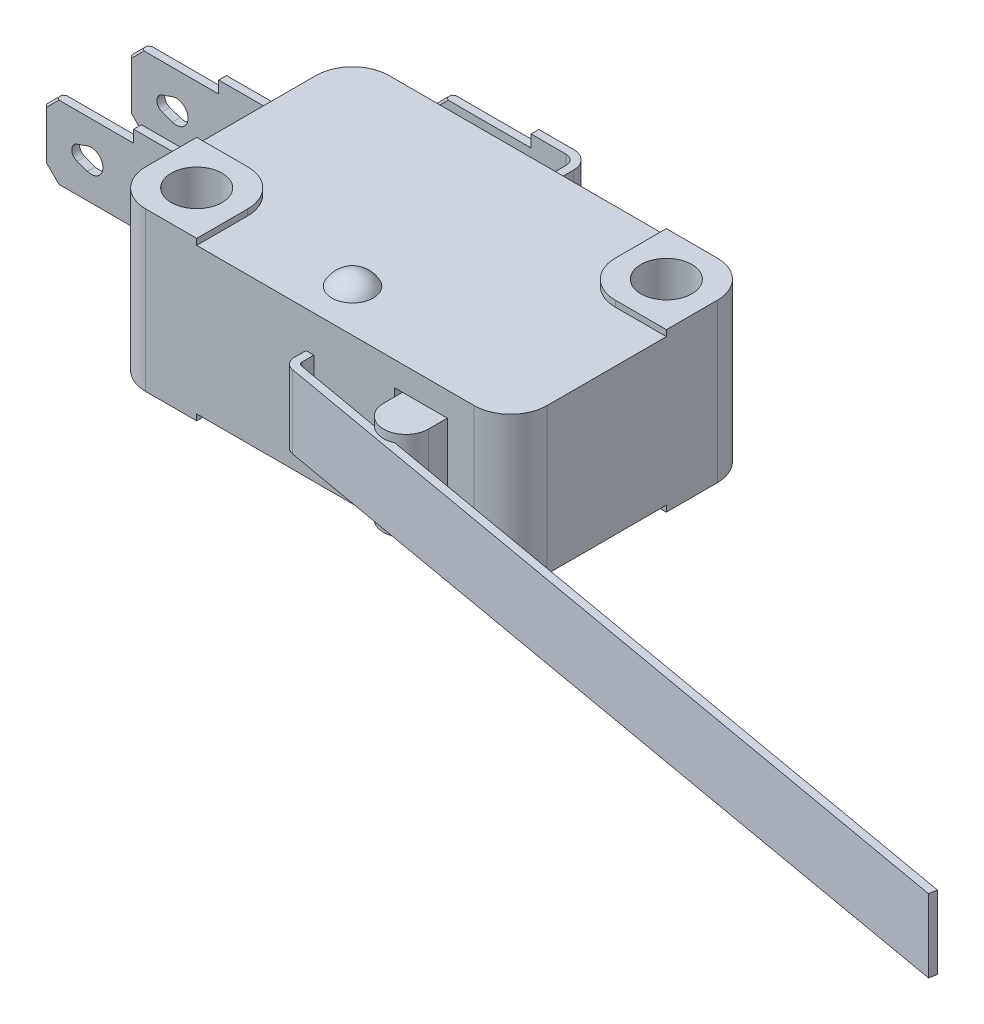
from build123d import *

# Parameters (mm, degrees)
BOSS_EXTRUDE1_DEPTH = 4.7625
BOSS_EXTRUDE2_DEPTH = 5.159375
BOSS_EXTRUDE3_DEPTH = 5.159375
SKETCH4_R           = 1.6637
CUT_EXTRUDE1_DEPTH  = 19.466419322
SKETCH5_W           = 2.38125
SKETCH5_H           = 5.55625
CUT_EXTRUDE2_DEPTH  = 2.38125
EXTRUDE_THIN1_DEPTH = 3.175
CUT_EXTRUDE3_REACH  = 25.891
SKETCH7_W           = 6.35
SKETCH7_H           = 0.79375
SKETCH8_W           = 10.31875
SKETCH8_H           = 0.508
EXTRUDE_THIN2_DEPTH = 3.175
SKETCH9_W           = 5.813488842
SKETCH9_H           = 0.79375
CUT_EXTRUDE4_DEPTH  = 72.39
CUT_EXTRUDE5_REACH  = 32.782
CUT_EXTRUDE6_DEPTH  = 27.884611297
CHAMFER1_SIZE       = 0.762
CHAMFER2_SIZE       = 0.127
SKETCH12_W          = 3.429
SKETCH12_H          = 6.35
CUT_EXTRUDE7_DEPTH  = 1.524
SKETCH13_W          = 2.921
SKETCH13_H          = 5.842
BOSS_EXTRUDE4_DEPTH = 3.96875
FILLET1_RADIUS      = 1.4605
FILLET1_LENGTH      = 5.842
EXTRUDE_THIN5_START = -2.38125
EXTRUDE_THIN5_DEPTH = 4.7625


# Read off the part's stored shape, not the designer's step: Extrude-Thin5
with BuildPart() as part:
    # Sketch1 → Boss-Extrude1 (new, symmetric)
    with BuildSketch(Plane(origin=(0, 0, 0), x_dir=(1, 0, 0), z_dir=(0, 1, 0))):
        with BuildLine():
            Line((-10.715625, 7.9375), (10.715625, 7.9375))
            ThreePointArc((10.715625, 7.9375), (12.399423023, 7.240048023), (13.096875, 5.55625))
            Line((13.096875, 5.55625), (13.096875, -5.55625))
            ThreePointArc((13.096875, -5.55625), (12.399423023, -7.240048023), (10.715625, -7.9375))
            Line((10.715625, -7.9375), (-10.715625, -7.9375))
            ThreePointArc((-10.715625, -7.9375), (-12.399423023, -7.240048023), (-13.096875, -5.55625))
            Line((-13.096875, -5.55625), (-13.096875, 5.55625))
            ThreePointArc((-13.096875, 5.55625), (-12.399423023, 7.240048023), (-10.715625, 7.9375))
        make_face()
    extrude(amount=BOSS_EXTRUDE1_DEPTH, both=True)

    # Sketch2 → Boss-Extrude2 (add, symmetric)
    with BuildSketch(Plane(origin=(0, 0, 0), x_dir=(1, 0, 0), z_dir=(0, 1, 0))):
        with BuildLine():
            Line((7.388225, 7.9375), (10.715625, 7.9375))
            ThreePointArc((10.715625, 7.9375), (12.399423023, 7.240048023), (13.096875, 5.55625))
            Line((13.096875, 5.55625), (13.096875, 2.22885))
            Line((13.096875, 2.22885), (9.769475, 2.22885))
            ThreePointArc((9.769475, 2.22885), (8.085676977, 2.926301977), (7.388225, 4.6101))
            Line((7.388225, 4.6101), (7.388225, 7.9375))
        make_face()
    extrude(amount=BOSS_EXTRUDE2_DEPTH, both=True)

    # Sketch3 → Boss-Extrude3 (add, symmetric)
    with BuildSketch(Plane(origin=(0, 0, 0), x_dir=(1, 0, 0), z_dir=(0, 1, 0))):
        with BuildLine():
            Line((-7.388225, -7.9375), (-10.715625, -7.9375))
            ThreePointArc((-10.715625, -7.9375), (-12.399423023, -7.240048023), (-13.096875, -5.55625))
            Line((-13.096875, -5.55625), (-13.096875, -2.22885))
            Line((-13.096875, -2.22885), (-9.769475, -2.22885))
            ThreePointArc((-9.769475, -2.22885), (-8.085676977, -2.926301977), (-7.388225, -4.6101))
            Line((-7.388225, -4.6101), (-7.388225, -7.9375))
        make_face()
    extrude(amount=BOSS_EXTRUDE3_DEPTH, both=True)

    # Sketch4 → Cut-Extrude1 (cut, through all)
    with BuildSketch(Plane(origin=(0, 5.159375, 0), x_dir=(1, 0, 0), z_dir=(0, 1, 0))):
        with Locations(Location((-10.24255, -5.083175, 0), (0, 0, 270))):
            Circle(SKETCH4_R)
        with Locations(Location((10.24255, 5.083175, 0), (0, 0, 270))):
            Circle(SKETCH4_R)
    extrude(amount=-CUT_EXTRUDE1_DEPTH, mode=Mode.SUBTRACT)

    # Sketch5 → Cut-Extrude2 (cut)
    with BuildSketch(Plane.ZY.offset(13.096875)):
        with Locations((-6.746875, 0)):
            Rectangle(SKETCH5_W, SKETCH5_H)
    extrude(amount=-CUT_EXTRUDE2_DEPTH, mode=Mode.SUBTRACT)

    # Sketch6 → Extrude-Thin1 (add, symmetric)
    with BuildSketch(Plane(origin=(0, 0, 0), x_dir=(1, 0, 0), z_dir=(0, 1, 0))):
        with BuildLine():
            Line((-0.936625, 7.9375), (-0.936625, 10.2235))
            ThreePointArc((-0.936625, 10.2235), (-1.271401949, 11.031723051), (-2.079625, 11.3665))
            Line((-2.079625, 11.3665), (-10.715625, 11.3665))
            Line((-10.715625, 11.3665), (-10.715625, 10.8585))
            Line((-10.715625, 10.8585), (-2.079625, 10.8585))
            ThreePointArc((-2.079625, 10.8585), (-1.630612194, 10.672512806), (-1.444625, 10.2235))
            Line((-1.444625, 10.2235), (-1.444625, 7.9375))
            Line((-1.444625, 7.9375), (-0.936625, 7.9375))
        make_face()
    extrude(amount=EXTRUDE_THIN1_DEPTH, both=True)

    # Sketch7 → Cut-Extrude3 (cut, up to next)
    with BuildSketch(Plane(origin=(0, 0, -11.3665), x_dir=(-1, 0, 0), z_dir=(0, 0, -1)), mode=Mode.PRIVATE) as cut_extrude3_sk1:
        with Locations((7.540625, 2.778125)):
            Rectangle(SKETCH7_W, SKETCH7_H)
    cut_extrude3_tool1 = extrude(cut_extrude3_sk1.sketch, amount=-CUT_EXTRUDE3_REACH, mode=Mode.PRIVATE) & part.part
    cut_extrude3 = cut_extrude3_tool1.solids().sort_by_distance((-7.540625, 2.778125, -11.3665))[0]
    add(cut_extrude3, mode=Mode.SUBTRACT)

    # Sketch8 → Extrude-Thin2 (add, symmetric)
    with BuildSketch(Plane(origin=(0, 0, 0), x_dir=(1, 0, 0), z_dir=(0, 1, 0))):
        with Locations((-18.25625, 3.96875)):
            Rectangle(SKETCH8_W, SKETCH8_H)
        with Locations((-18.25625, -1.5875)):
            Rectangle(SKETCH8_W, SKETCH8_H)
    extrude(amount=EXTRUDE_THIN2_DEPTH, both=True)

    # Sketch9 → Cut-Extrude4 (cut)
    with BuildSketch(Plane(origin=(0, 0, -4.22275), x_dir=(-1, 0, 0), z_dir=(0, 0, -1))):
        with Locations((20.508880579, 2.778125)):
            Rectangle(SKETCH9_W, SKETCH9_H)
    cut_extrude4 = extrude(amount=-CUT_EXTRUDE4_DEPTH, mode=Mode.SUBTRACT)

    # Mirror1: Cut-Extrude3, Cut-Extrude4 across plane
    add(cut_extrude3.mirror(Plane.ZX), mode=Mode.SUBTRACT)
    add(cut_extrude4.mirror(Plane.ZX), mode=Mode.SUBTRACT)

    # Sketch10 → Cut-Extrude5 (cut, up to next)
    with BuildSketch(Plane(origin=(0, 0, -11.3665), x_dir=(-1, 0, 0), z_dir=(0, 0, -1)), mode=Mode.PRIVATE) as cut_extrude5_sk1:
        with BuildLine():
            Line((7.032625, 0.71842049), (7.709958333, 0.478946993))
            ThreePointArc((7.709958333, 0.478946993), (8.048625, 0), (7.709958333, -0.478946993))
            Line((7.709958333, -0.478946993), (7.032625, -0.71842049))
            ThreePointArc((7.032625, -0.71842049), (6.016625, 0), (7.032625, 0.71842049))
        make_face()
    cut_extrude5_tool1 = extrude(cut_extrude5_sk1.sketch, amount=-CUT_EXTRUDE5_REACH, mode=Mode.PRIVATE) & part.part
    add(cut_extrude5_tool1.solids().sort_by_distance((-6.978953, 0, -11.3665))[0], mode=Mode.SUBTRACT)

    # Sketch11 → Cut-Extrude6 (cut, through all)
    with BuildSketch(Plane(origin=(0, 0, -4.22275), x_dir=(-1, 0, 0), z_dir=(0, 0, -1))):
        with BuildLine():
            Line((20.621625, 0.71842049), (21.298958333, 0.478946993))
            ThreePointArc((21.298958333, 0.478946993), (21.637625, 0), (21.298958333, -0.478946993))
            Line((21.298958333, -0.478946993), (20.621625, -0.71842049))
            ThreePointArc((20.621625, -0.71842049), (19.605625, 0), (20.621625, 0.71842049))
        make_face()
    extrude(amount=-CUT_EXTRUDE6_DEPTH, mode=Mode.SUBTRACT)

    # Chamfer1
    chamfer1_edges = [part.edges().sort_by_distance(p)[0] for p in [
        (-10.715625, 2.38125, -11.1125),
        (-23.415625, 2.38125, 1.5875),
        (-23.415625, 2.38125, -3.96875),
        (-10.715625, -2.38125, -11.1125),
        (-23.415625, -2.38125, 1.5875),
        (-23.415625, -2.38125, -3.96875),
    ]]
    chamfer(chamfer1_edges, length=CHAMFER1_SIZE)

    # Chamfer2
    chamfer2_edges = [part.edges().sort_by_distance(p)[0] for p in [
        (-10.715625, 0, -11.3665),
        (-10.715625, 0, -10.8585),
        (-10.334625, -2.00025, -11.3665),
        (-10.334625, 2.00025, -11.3665),
        (-10.334625, -2.00025, -10.8585),
        (-10.334625, 2.00025, -10.8585),
        (-23.415625, 0, 1.3335),
        (-23.034625, 2.00025, 1.3335),
        (-23.034625, -2.00025, 1.3335),
        (-23.415625, 0, 1.8415),
        (-23.034625, 2.00025, 1.8415),
        (-23.034625, -2.00025, 1.8415),
        (-23.415625, 0, -4.22275),
        (-23.415625, 0, -3.71475),
        (-23.034625, -2.00025, -4.22275),
        (-23.034625, 2.00025, -4.22275),
        (-23.034625, -2.00025, -3.71475),
        (-23.034625, 2.00025, -3.71475),
    ]]
    chamfer(chamfer2_edges, length=CHAMFER2_SIZE)

    # Sketch12 → Cut-Extrude7 (cut)
    with BuildSketch(Plane.XY.offset(7.9375)):
        with Locations((7.2517, 0)):
            Rectangle(SKETCH12_W, SKETCH12_H)
    extrude(amount=-CUT_EXTRUDE7_DEPTH, mode=Mode.SUBTRACT)

    # Sketch13 → Boss-Extrude4 (add)
    with BuildSketch(Plane.XY.offset(6.4135)):
        with Locations((7.2517, 0)):
            Rectangle(SKETCH13_W, SKETCH13_H)
    extrude(amount=BOSS_EXTRUDE4_DEPTH)

    # Fillet1: full round fillet: the end face becomes a half cylinder, R = half its width
    fillet1_face = Plane((7.2517, 0, 10.38225), x_dir=(0, -1, 0), z_dir=(0, 0, 1))  # on the end face: x along it, z out of the body
    fillet1_slab = fillet1_face.offset(-FILLET1_RADIUS / 2) * Box(FILLET1_LENGTH, 2 * FILLET1_RADIUS, FILLET1_RADIUS, mode=Mode.PRIVATE)  # the body's end, R deep
    fillet1_round = Plane((7.2517, 0, 8.92175), x_dir=(0, 0, 1), z_dir=(0, -1, 0)) * Cylinder(FILLET1_RADIUS, FILLET1_LENGTH, mode=Mode.PRIVATE)  # its axis R under the face
    add(fillet1_slab - fillet1_round, mode=Mode.SUBTRACT)

    # Sketch14 → Revolve1 (revolve)
    with BuildSketch(Plane(origin=(0, 0, 0), x_dir=(0, 0, -1), z_dir=(1, 0, 0))):
        with BuildLine():
            Line((-5.1562, -4.7625), (-5.1562, -5.581854839))
            ThreePointArc((-5.1562, -5.581854839), (-5.946357191, -5.361015463), (-6.507514618, -4.7625))
            Line((-6.507514618, -4.7625), (-5.1562, -4.7625))
        make_face()
    revolve1 = revolve(axis=Axis((0, -4.7625, 5.1562), (0, -1, 0)))

    # Mirror2: Revolve1 across plane
    add(revolve1.mirror(Plane.ZX))

    # Extrude-Thin5 outline → Extrude-Thin5 (add)
    with BuildSketch(Plane(origin=(0, 0, 0), x_dir=(1, 0, 0), z_dir=(0, 1, 0)).offset(EXTRUDE_THIN5_START)):
        with BuildLine():
            Line((50.755963212, -18.321063831), (50.844036788, -17.82075688))
            Line((50.844036788, -17.82075688), (7.853115161, -10.252674511))
            ThreePointArc((7.853115161, -10.252674511), (6.998488468, -10.360132484), (6.231935352, -9.967283506))
            Line((6.231935352, -9.967283506), (0.463963212, -8.951894987))
            ThreePointArc((0.463963212, -8.951894987), (0.313447508, -8.865036728), (0.254, -8.701741511))
            Line((0.254, -8.701741511), (0.254, -7.9375))
            Line((0.254, -7.9375), (-0.254, -7.9375))
            Line((-0.254, -7.9375), (-0.254, -8.701741511))
            ThreePointArc((-0.254, -8.701741511), (-0.075657476, -9.191627163), (0.375889636, -9.452201938))
            Line((0.375889636, -9.452201938), (50.755963212, -18.321063831))
        make_face()
    extrude(amount=EXTRUDE_THIN5_DEPTH)


solid = part.part
